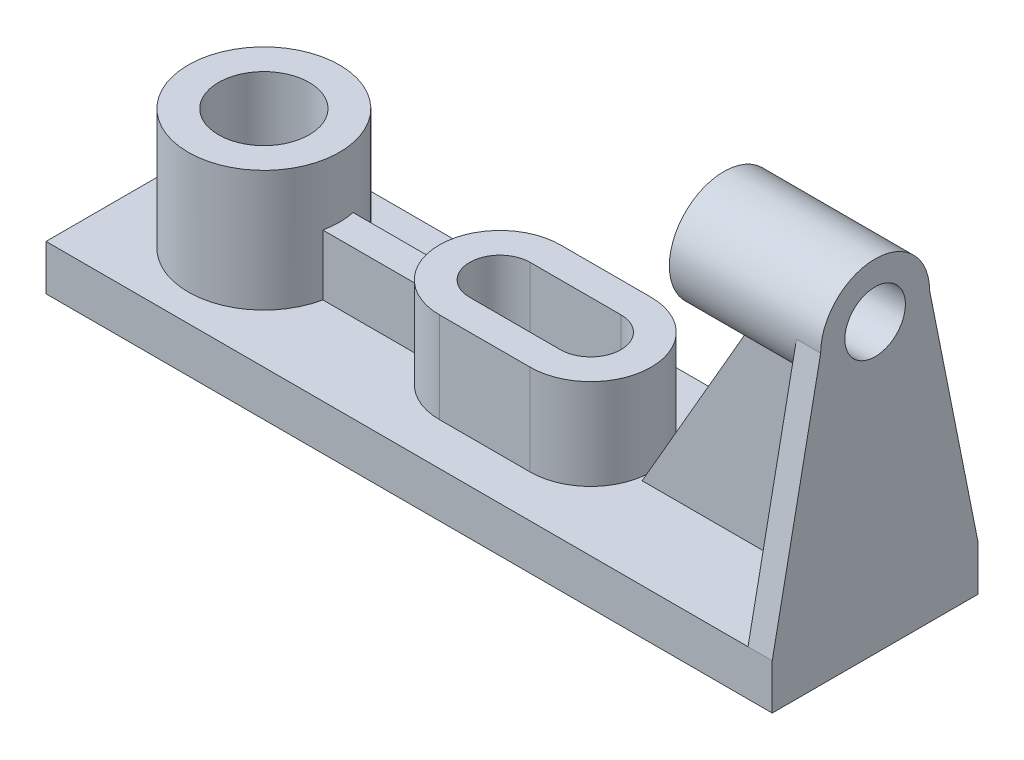
from build123d import *
from build123d.topology import SkipClean

# Parameters (mm, degrees)
SKETCH2_W           = 240
SKETCH2_H           = 68
BOSS_EXTRUDE1_DEPTH = 15
SKETCH4_R           = 25
SKETCH4_R_2         = 15
BOSS_EXTRUDE4_DEPTH = 40
CUT_EXTRUDE2_START  = -40
SKETCH7_R           = 15
CUT_EXTRUDE2_DEPTH  = 40
BOSS_EXTRUDE5_DEPTH = 30
CUT_EXTRUDE3_DEPTH  = 77
RIB3_REACH          = 138.312
SKETCH11_WALL_W     = 307.624283584
SKETCH11_WALL_H     = 10
BOSS_EXTRUDE6_DEPTH = 8
SKETCH13_R          = 18
BOSS_EXTRUDE7_DEPTH = 42
SKETCH14_R          = 10
CUT_EXTRUDE4_DEPTH  = 67
RIB14_REACH         = 170.3
SKETCH19_WALL_W     = 410.192086974
SKETCH19_WALL_H     = 8


with BuildPart() as part:
    # Sketch2 → Boss-Extrude1 (new body)
    with BuildSketch(Plane(origin=(0, 0, 0), x_dir=(1, 0, 0), z_dir=(0, 1, 0))):
        Rectangle(SKETCH2_W, SKETCH2_H)
    extrude(amount=BOSS_EXTRUDE1_DEPTH)

    # Sketch4 → Boss-Extrude4 (add)
    with BuildSketch(Plane(origin=(0, 15, 0), x_dir=(1, 0, 0), z_dir=(0, 1, 0))):
        with Locations((-82, 0)):
            Circle(SKETCH4_R)
        with Locations((-82, 0)):
            Circle(SKETCH4_R_2, mode=Mode.SUBTRACT)
    extrude(amount=BOSS_EXTRUDE4_DEPTH)

    # Sketch7 → Cut-Extrude2 (cut)
    with BuildSketch(Plane(origin=(0, 15, 0), x_dir=(1, 0, 0), z_dir=(0, 1, 0)).offset(CUT_EXTRUDE2_START)):
        with Locations((-82, 0)):
            Circle(SKETCH7_R)
    extrude(amount=CUT_EXTRUDE2_DEPTH, mode=Mode.SUBTRACT)

    # Sketch8 → Boss-Extrude5 (add)
    with BuildSketch(Plane(origin=(0, 15, 0), x_dir=(1, 0, 0), z_dir=(0, 1, 0))):
        with BuildLine():
            Line((-4, 20), (26, 20))
            ThreePointArc((26, 20), (46, 0), (26, -20))
            Line((26, -20), (-4, -20))
            ThreePointArc((-4, -20), (-24, 0), (-4, 20))
        make_face()
    extrude(amount=BOSS_EXTRUDE5_DEPTH)

    # Sketch9 → Cut-Extrude3 (cut)
    with BuildSketch(Plane(origin=(0, 45, 0), x_dir=(1, 0, 0), z_dir=(0, 1, 0))):
        with BuildLine():
            Line((-4, -10), (26, -10))
            ThreePointArc((26, -10), (36, 0), (26, 10))
            Line((26, 10), (-4, 10))
            ThreePointArc((-4, 10), (-14, 0), (-4, -10))
        make_face()
    extrude(amount=-CUT_EXTRUDE3_DEPTH, mode=Mode.SUBTRACT)

    # Sketch11 wall → Rib3 (add, up to next)
    with BuildSketch(Plane(origin=(-40.5, 35, 0), x_dir=(1, 0, 0), z_dir=(0, 1, 0)), mode=Mode.PRIVATE) as rib3_sk1:
        Rectangle(SKETCH11_WALL_W, SKETCH11_WALL_H)
    rib3_tool1 = extrude(rib3_sk1.sketch, amount=-RIB3_REACH, mode=Mode.PRIVATE) - part.part
    add(rib3_tool1.solids().sort_by_distance((-40.5, 35, 0))[0])

    # Sketch12 → Boss-Extrude6 (add)
    with BuildSketch(Plane(origin=(120, 0, 0), x_dir=(0, 0, -1), z_dir=(1, 0, 0))):
        with BuildLine():
            Line((-18, 95), (-34, 15))
            Line((-34, 15), (34, 15))
            Line((34, 15), (18, 95))
            ThreePointArc((18, 95), (0, 113), (-18, 95))
        make_face()
    extrude(amount=-BOSS_EXTRUDE6_DEPTH)

    # Sketch13 → Boss-Extrude7 (add)
    with SkipClean():  # the faces are left unmerged after this step: merging them gives an invalid solid
        with BuildSketch(Plane.ZY.offset(-112)):
            with Locations((0, 95)):
                Circle(SKETCH13_R)
        extrude(amount=BOSS_EXTRUDE7_DEPTH)
    add(part.part.scale(1), mode=Mode.REPLACE)  # the faces are merged on a copy

    # Sketch14 → Cut-Extrude4 (cut)
    with BuildSketch(Plane.ZY.offset(-70)):
        with Locations((0, 95)):
            Circle(SKETCH14_R)
    extrude(amount=-CUT_EXTRUDE4_DEPTH, mode=Mode.SUBTRACT)

    # Sketch19 wall → Rib14 (add, up to next)
    with BuildSketch(Plane(origin=(64.897858345, 46, 0), x_dir=(-0.500000000003, -0.866025403783, 0), z_dir=(0.866025403783, -0.500000000003, 0)), mode=Mode.PRIVATE) as rib14_sk1:
        Rectangle(SKETCH19_WALL_W, SKETCH19_WALL_H)
    rib14_tool1 = extrude(rib14_sk1.sketch, amount=RIB14_REACH, mode=Mode.PRIVATE) - part.part
    add(rib14_tool1.solids().sort_by_distance((64.897858345, 46, 0))[0])


solid = part.part
